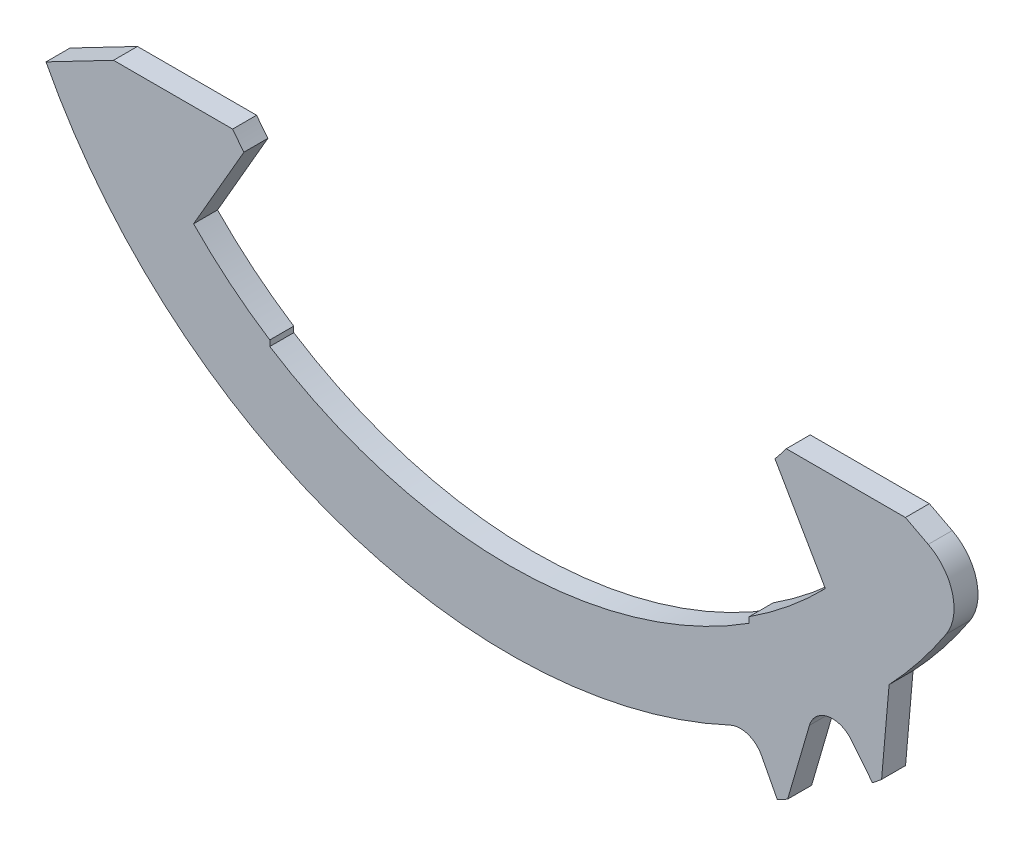
from build123d import *

# Parameters (mm, degrees)
OTHER_10076_5_DEPTH = 0.5
CUT_EXTRUDE1_START  = -0.5
CUT_EXTRUDE1_DEPTH  = 0.5


# Read off the part's stored shape, not the designer's step: 10076-5
with BuildPart() as part:
    # Other 10076-5 outline → Other 10076-5 (new body)
    with BuildSketch(Plane.XY):
        with BuildLine():
            ThreePointArc((7.573674013, -9.436602245), (7.668819519, -9.359444812), (7.763179028, -9.281328104))
            Line((7.763179028, -9.281328104), (7.919995926, -7.488902759))
            ThreePointArc((7.919995926, -7.488902759), (8.548470738, -6.76266575), (9.110578105, -5.983925684))
            ThreePointArc((9.110578105, -5.983925684), (9.242448569, -5.182849851), (8.736493865, -4.547930843))
            Line((8.736493865, -4.547930843), (8.260223146, -4.3))
            Line((8.260223146, -4.3), (5.774945887, -4.3))
            ThreePointArc((5.774945887, -4.3), (5.659072475, -4.451392897), (5.53923133, -4.5996648))
            Line((5.53923133, -4.5996648), (6.59, -6.419649523))
            ThreePointArc((6.59, -6.419649523), (5.831509763, -7.1157216), (5, -7.722693831))
            Line((5, -7.722693831), (5, -7.841555968))
            ThreePointArc((5, -7.841555968), (0, -9.3), (-5, -7.841555968))
            Line((-5, -7.841555968), (-5, -7.722693831))
            ThreePointArc((-5, -7.722693831), (-5.831509763, -7.1157216), (-6.59, -6.419649523))
            Line((-6.59, -6.419649523), (-5.53923133, -4.5996648))
            ThreePointArc((-5.53923133, -4.5996648), (-5.659072475, -4.451392897), (-5.774945887, -4.3))
            Line((-5.774945887, -4.3), (-8.260223146, -4.3))
            Line((-8.260223146, -4.3), (-10.732831081, -5.58715822))
            ThreePointArc((-10.732831081, -5.58715822), (-10.675718173, -5.6955282), (-10.617511084, -5.803314431))
            Line((-10.617511084, -5.803314431), (-9.055174855, -6.258693914))
            ThreePointArc((-9.055174855, -6.258693914), (-8.704696722, -6.64117368), (-8.882127626, -7.128661083))
            Line((-8.882127626, -7.128661083), (-9.436602245, -7.573674013))
            ThreePointArc((-9.436602245, -7.573674013), (-9.359444812, -7.668819519), (-9.281328104, -7.763179028))
            Line((-9.281328104, -7.763179028), (-7.660171598, -7.905011844))
            ThreePointArc((-7.660171598, -7.905011844), (-7.241809703, -8.211767477), (-7.320727248, -8.724502998))
            Line((-7.320727248, -8.724502998), (-7.777730077, -9.269137762))
            ThreePointArc((-7.777730077, -9.269137762), (-7.683493234, -9.347402405), (-7.588468891, -9.424709008))
            Line((-7.588468891, -9.424709008), (-5.970792243, -9.247544602))
            ThreePointArc((-5.970792243, -9.247544602), (-5.500623999, -9.466787654), (-5.477995427, -9.985067155))
            Line((-5.477995427, -9.985067155), (-5.819964104, -10.608393744))
            ThreePointArc((-5.819964104, -10.608393744), (-5.712269322, -10.666769858), (-5.603989074, -10.724052707))
            Line((-5.603989074, -10.724052707), (-4.05195869, -10.234699407))
            ThreePointArc((-4.05195869, -10.234699407), (-3.548052399, -10.358004491), (-3.424747314, -10.861910782))
            Line((-3.424747314, -10.861910782), (-3.638540174, -11.539975104))
            ThreePointArc((-3.638540174, -11.539975104), (-3.521526102, -11.576219327), (-3.404151099, -11.611277074))
            Line((-3.404151099, -11.611277074), (-1.977410637, -10.828540453))
            ThreePointArc((-1.977410637, -10.828540453), (-1.459131136, -10.851169025), (-1.239888083, -11.321337268))
            Line((-1.239888083, -11.321337268), (-1.317289186, -12.028081692))
            ThreePointArc((-1.317289186, -12.028081692), (-1.195452609, -12.04080118), (-1.073493507, -12.052286575))
            Line((-1.073493507, -12.052286575), (0.173128198, -11.006246762))
            ThreePointArc((0.173128198, -11.006246762), (0.685863719, -10.927329218), (0.992619352, -11.345691113))
            Line((0.992619352, -11.345691113), (1.054584487, -12.053955847))
            ThreePointArc((1.054584487, -12.053955847), (1.176561457, -12.042661796), (1.298417839, -12.030133462))
            Line((1.298417839, -12.030133462), (2.317013814, -10.760989181))
            ThreePointArc((2.317013814, -10.760989181), (2.804501216, -10.583558277), (3.186980982, -10.93403641))
            Line((3.186980982, -10.93403641), (3.38593107, -11.616603238))
            ThreePointArc((3.38593107, -11.616603238), (3.503360927, -11.581729673), (3.620431715, -11.545669067))
            Line((3.620431715, -11.545669067), (4.371857887, -10.10219282))
            ThreePointArc((4.371857887, -10.10219282), (4.815363304, -9.833067127), (5.258868721, -10.10219282))
            Line((5.258868721, -10.10219282), (5.58715822, -10.732831081))
            ThreePointArc((5.58715822, -10.732831081), (5.6955282, -10.675718173), (5.803314431, -10.617511084))
            Line((5.803314431, -10.617511084), (6.258693914, -9.055174855))
            ThreePointArc((6.258693914, -9.055174855), (6.64117368, -8.704696722), (7.128661083, -8.882127626))
            Line((7.128661083, -8.882127626), (7.573674013, -9.436602245))
        make_face()
    extrude(amount=OTHER_10076_5_DEPTH)

    # Sketch1 → Cut-Extrude1 (cut)
    with BuildSketch(Plane.XY.offset(0.5).offset(CUT_EXTRUDE1_START)):
        with BuildLine():
            Line((-9.668418082, -5.033059884), (-10.732831081, -5.58715822))
            ThreePointArc((-10.732831081, -5.58715822), (-4.639236905, -11.175306749), (3.620431715, -11.545669067))
            Line((3.620431715, -11.545669067), (4.371857887, -10.10219282))
            ThreePointArc((4.371857887, -10.10219282), (4.469650209, -9.971843573), (4.604163159, -9.879862428))
            ThreePointArc((4.604163159, -9.879862428), (-3.50493127, -10.321117032), (-9.668418082, -5.033059884))
        make_face()
    extrude(amount=CUT_EXTRUDE1_DEPTH, mode=Mode.SUBTRACT)


solid = part.part
